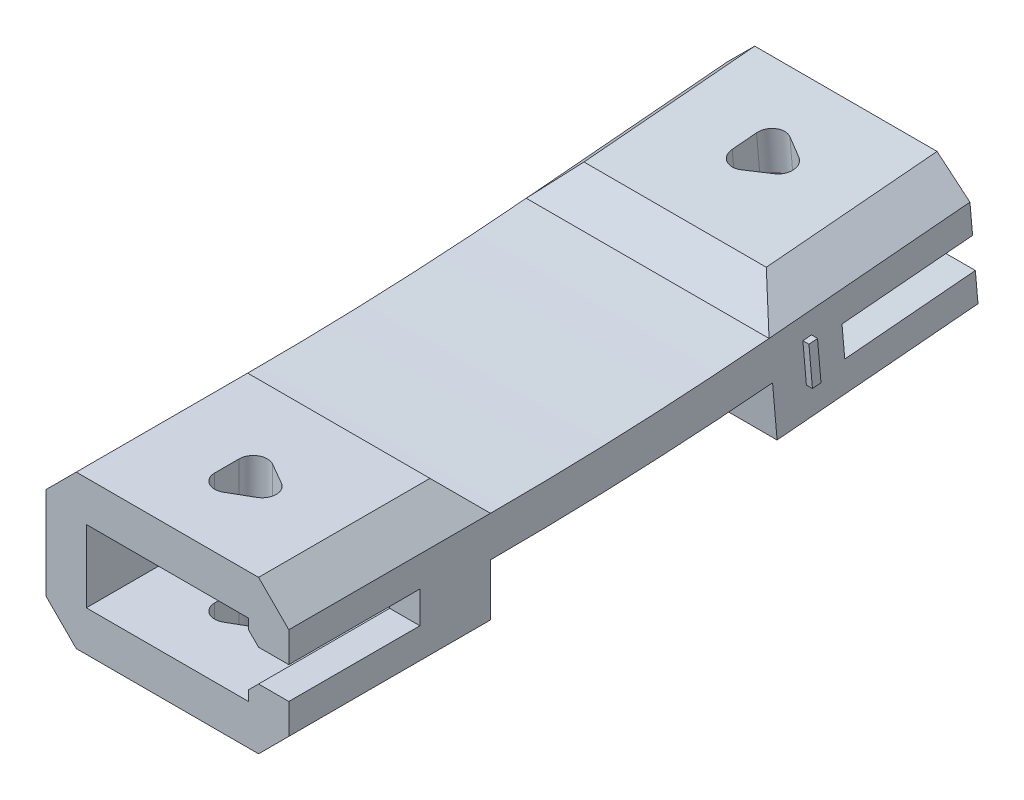
from build123d import *

# Parameters (mm, degrees)
SKETCH1_W               = 12.04
SKETCH1_H               = 7.58
SKETCH1_W_2             = 8.04
SKETCH1_H_2             = 3.58
BOSS_EXTRUDE1_DEPTH     = 8
SKETCH1_2_W             = 12.04
SKETCH1_2_H             = 7.58
SKETCH1_2_W_2           = 8.04
SKETCH1_2_H_2           = 3.58
BOSS_EXTRUDE2_DEPTH     = 2
EXTRUDE_THIN1_START     = -12.04
EXTRUDE_THIN1_DEPTH     = 12.04
SKETCH5_W               = 12.04
SKETCH5_H               = 7.58
SKETCH5_W_2             = 8.04
SKETCH5_H_2             = 3.58
BOSS_EXTRUDE4_DEPTH     = 10
SKETCH5_4_W             = 12.04
SKETCH5_4_H             = 7.58
BOSS_EXTRUDE5_DEPTH     = 2
CHAMFER1_SIZE           = 1.5
CUT_EXTRUDE1_DEPTH      = 29.028711337
CUT_EXTRUDE1_DEPTH_BACK = 29.028711337
CUT_EXTRUDE2_DEPTH      = 29.071269996
CUT_EXTRUDE2_DEPTH_BACK = 29.071269996
SKETCH8_W               = 4
SKETCH8_H               = 1.58
CUT_EXTRUDE3_DEPTH      = 6.5
SKETCH9_W               = 4
SKETCH9_H               = 1.58
CUT_EXTRUDE4_DEPTH      = 6.5
CHAMFER2_SIZE           = 0.5
BOSS_EXTRUDE8_DEPTH     = 0.3


with BuildPart() as part:
    # Sketch1 → Boss-Extrude1 (new body)
    with BuildSketch(Plane.XY):
        Rectangle(SKETCH1_W, SKETCH1_H)
        Rectangle(SKETCH1_W_2, SKETCH1_H_2, mode=Mode.SUBTRACT)
    extrude(amount=BOSS_EXTRUDE1_DEPTH)

    # Sketch1<2> → Boss-Extrude2 (add)
    # profile 1 of 2: a face of its own
    with BuildSketch(Plane.XY):
        Rectangle(SKETCH1_2_W, SKETCH1_2_H)
        Rectangle(SKETCH1_2_W_2, SKETCH1_2_H_2, mode=Mode.SUBTRACT)
    # profile 2 of 2: a face of its own
    with BuildSketch(Plane.XY):
        Rectangle(SKETCH1_2_W_2, SKETCH1_2_H_2)
    extrude(amount=-BOSS_EXTRUDE2_DEPTH)

    # Sketch3 → Extrude-Thin1 (add)
    with BuildSketch(Plane(origin=(6.02, 9.81, 0), x_dir=(0, -1, 0), z_dir=(1, 0, 0)).offset(EXTRUDE_THIN1_START)):
        with BuildLine():
            Line((13.6, 2), (9.52, 2))
            ThreePointArc((9.52, 2), (9.367259482, 9), (8.909328677, 15.986675107))
            Line((8.909328677, 15.986675107), (12.973803045, 16.342270537))
            Line((12.973803045, 16.342270537), (12.799491559, 18.334659933))
            Line((12.799491559, 18.334659933), (6.730055387, 17.803653074))
            ThreePointArc((6.730055387, 17.803653074), (7.369163038, 8.912761225), (7.507379539, 0))
            Line((7.507379539, 0), (13.6, 0))
            Line((13.6, 0), (13.6, 2))
        make_face()
    extrude(amount=EXTRUDE_THIN1_DEPTH)

    # Sketch5 → Boss-Extrude4 (add)
    with BuildSketch(Plane(origin=(0, -2.356055999, -16.271601827), x_dir=(-1, 0, 0), z_dir=(0, 0.08715574274765182, -0.9961946980917462))):
        with Locations((0, 2.979167492)):
            Rectangle(SKETCH5_W, SKETCH5_H)
        with Locations((0, 2.979167492)):
            Rectangle(SKETCH5_W_2, SKETCH5_H_2, mode=Mode.SUBTRACT)
    extrude(amount=BOSS_EXTRUDE4_DEPTH)

    # Sketch5<4> → Boss-Extrude5 (add)
    with BuildSketch(Plane(origin=(0, -2.356055999, -16.271601827), x_dir=(-1, 0, 0), z_dir=(0, 0.08715574274765182, -0.9961946980917462))):
        with Locations((0, 2.979167492)):
            Rectangle(SKETCH5_4_W, SKETCH5_4_H)
    extrude(amount=BOSS_EXTRUDE5_DEPTH)

    # Chamfer1
    chamfer1_edges = [part.edges().sort_by_distance(p)[0] for p in [
        (0, -3.79, -2),
        (0, 3.79, -2),
        (-6.02, -2.728024331, -21.323244027),
        (6.02, -2.728024331, -21.323244027),
        (0, -3.163803045, -16.342270537),
        (6.02, -3.79, 3),
        (-6.02, -3.79, 3),
        (-6.02, 3.79, 3),
        (6.02, 3.79, 3),
        (0, 4.387352767, -15.681630007),
        (6.02, 4.82313148, -20.662603497),
        (-6.02, 4.82313148, -20.662603497),
    ]]
    chamfer(chamfer1_edges, length=CHAMFER1_SIZE - 0.0001)  # a hair under: the kernel refuses the full size

    # Sketch6 → Cut-Extrude1 (cut, two sides: drawn at the far end of the back side and taken through both)
    with BuildSketch(Plane(origin=(0, 3.79, 0), x_dir=(1, 0, 0), z_dir=(0, 1, 0)).offset(-CUT_EXTRUDE1_DEPTH_BACK)):
        with BuildLine():
            Line((1.05, -3.393782217), (0, -2.787564435))
            ThreePointArc((0, -2.787564435), (-0.7, -2.787564435), (-1.05, -3.393782217))
            Line((-1.05, -3.393782217), (-1.05, -4.606217783))
            ThreePointArc((-1.05, -4.606217783), (-0.7, -5.212435565), (0, -5.212435565))
            Line((0, -5.212435565), (1.05, -4.606217783))
            ThreePointArc((1.05, -4.606217783), (1.4, -4), (1.05, -3.393782217))
        make_face()
    extrude(amount=CUT_EXTRUDE1_DEPTH + CUT_EXTRUDE1_DEPTH_BACK, mode=Mode.SUBTRACT)

    # Sketch7 → Cut-Extrude2 (cut, two sides: drawn at the far end of the back side and taken through both)
    with BuildSketch(Plane(origin=(0, 2.992482656, 0.261808308), x_dir=(1, 0, 0), z_dir=(0, 0.9961946980917462, 0.08715574274765181)).offset(-CUT_EXTRUDE2_DEPTH_BACK)):
        with BuildLine():
            Line((1.05, 22.610557442), (0, 23.216775225))
            ThreePointArc((0, 23.216775225), (-0.7, 23.216775225), (-1.05, 22.610557442))
            Line((-1.05, 22.610557442), (-1.05, 21.398121877))
            ThreePointArc((-1.05, 21.398121877), (-0.7, 20.791904094), (0, 20.791904094))
            Line((0, 20.791904094), (1.05, 21.398121877))
            ThreePointArc((1.05, 21.398121877), (1.4, 22.004339659), (1.05, 22.610557442))
        make_face()
    extrude(amount=CUT_EXTRUDE2_DEPTH + CUT_EXTRUDE2_DEPTH_BACK, mode=Mode.SUBTRACT)

    # Sketch8 → Cut-Extrude3 (cut)
    with BuildSketch(Plane(origin=(0, 2.266427538, -25.905385296), x_dir=(-1, 0, 0), z_dir=(0, 0.08715574274765193, -0.9961946980917461))):
        with Locations((-6.02, -0.786086546)):
            Rectangle(SKETCH8_W, SKETCH8_H)
    extrude(amount=-CUT_EXTRUDE3_DEPTH, mode=Mode.SUBTRACT)

    # Sketch9 → Cut-Extrude4 (cut)
    with BuildSketch(Plane.XY.offset(8)):
        with Locations((6.02, 0)):
            Rectangle(SKETCH9_W, SKETCH9_H)
    extrude(amount=-CUT_EXTRUDE4_DEPTH, mode=Mode.SUBTRACT)

    # Chamfer2
    chamfer2_edges = [part.edges().sort_by_distance(p)[0] for p in [
        (4.02, 0.413082313, -22.805117521),
        (4.02, 0.91681996, -19.498631715),
        (4.02, 1.987069936, -22.667411447),
        (4.02, 0.79, 4.75),
        (4.02, 0, 1.5),
        (4.02, -0.79, 4.75),
    ]]
    chamfer(chamfer2_edges, length=CHAMFER2_SIZE)

    # Sketch12 → Boss-Extrude8 (add)
    with BuildSketch(Plane(origin=(6.02, 0, 0), x_dir=(0, 0, -1), z_dir=(1, 0, 0))):
        Polygon((17.914805855, 1.992834285), (18.088967441, 0.000456236), (17.664424758, -0.036510227), (17.490263173, 1.955867821), align=None)
    extrude(amount=BOSS_EXTRUDE8_DEPTH)


solid = part.part
